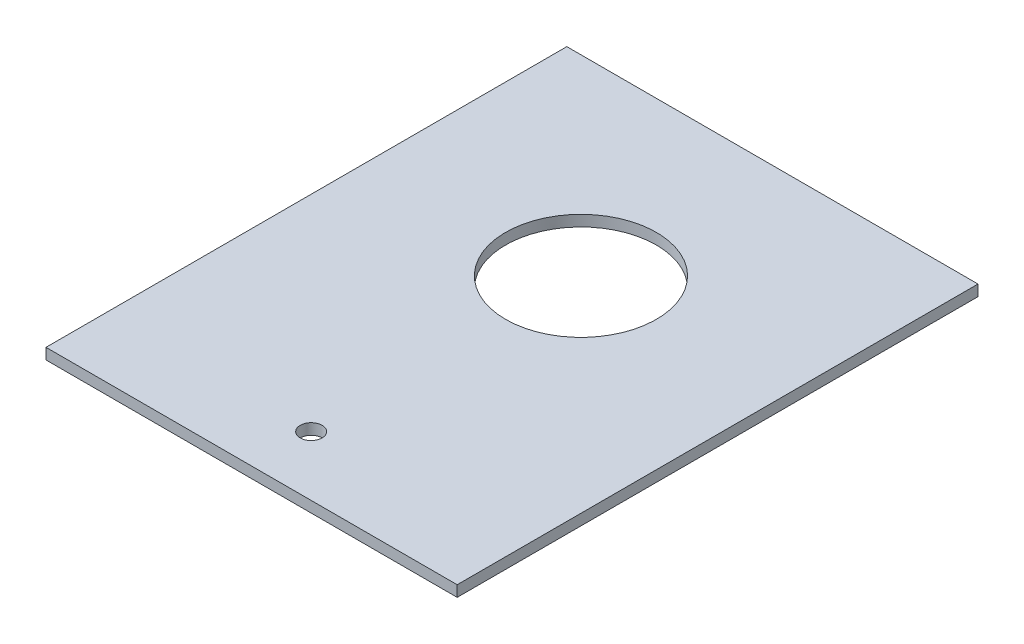
from build123d import *

# Parameters (mm, degrees)
SKETCH1_W           = 150
SKETCH1_H           = 190
BOSS_EXTRUDE1_DEPTH = 4
HOLE1_D             = 55
HOLE1_DEPTH         = 100
HOLE2_D             = 8
HOLE2_DEPTH         = 100


with BuildPart() as part:
    # Sketch1 → Boss-Extrude1 (new body)
    with BuildSketch(Plane(origin=(0, 32, 0), x_dir=(1, 0, 0), z_dir=(0, 1, 0))):
        with Locations((0, -25.157065581)):
            Rectangle(SKETCH1_W, SKETCH1_H)
    extrude(amount=BOSS_EXTRUDE1_DEPTH)

    # Hole1
    with Locations(Plane(origin=(0, 36, 0), x_dir=(1, 0, 0), z_dir=(0, 1, 0))):
        with Locations((0, 0)):
            Hole(HOLE1_D / 2, depth=HOLE1_DEPTH)

    # Hole2
    with Locations(Plane(origin=(0, 36, 0), x_dir=(1, 0, 0), z_dir=(0, 1, 0))):
        with Locations((0, -98.42)):
            Hole(HOLE2_D / 2, depth=HOLE2_DEPTH)


solid = part.part
